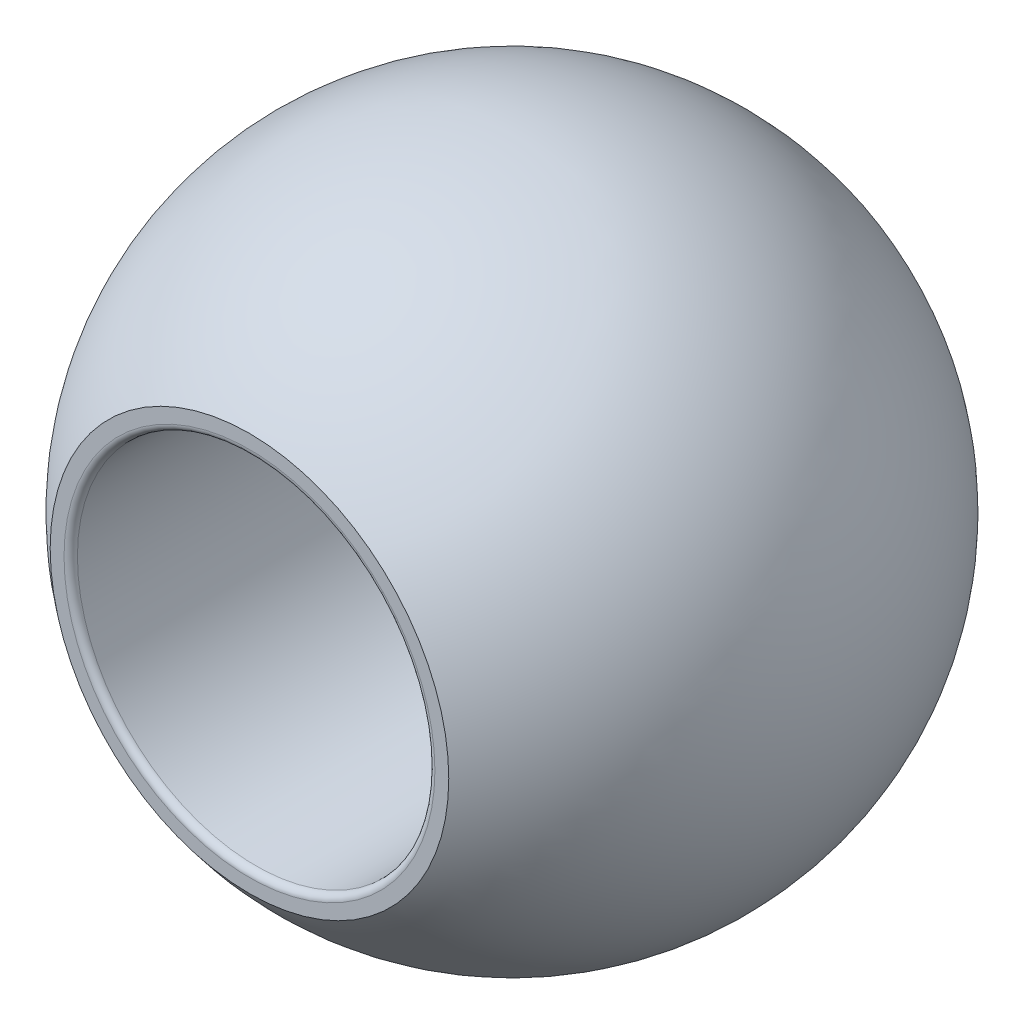
from build123d import *

# Parameters (mm, degrees)
ENL_V_MAT_EXTRU_1_REACH             = 7.11
ESQUISSE2_R                         = 1.6
ENL_V_MAT_EXTRU_1_DIRECTION_2_REACH = 7.11
ESQUISSE3_W                         = 3.87706385
ESQUISSE3_H                         = 0.15
ENL_V_MAT_EXTRU_2_DEPTH             = 6.109549882
CONG_2_R                            = 0.06
CONG_2_OF_SYM_TRIE1_R               = 0.06


with BuildPart() as part:
    # Esquisse1 → Révolution1 (revolve)
    with BuildSketch(Plane.XY):
        with BuildLine():
            Line((0, 2.95), (0, -2.95))
            ThreePointArc((0, -2.95), (-2.95, 0), (0, 2.95))
        make_face()
    revolve(axis=Axis((0, 4.043436293, 0), (0, -1, 0)))

    # Esquisse2 → Enlèv. mat.-Extru.1 (cut, up to next)
    with BuildSketch(Plane.XY, mode=Mode.PRIVATE) as enl_v_mat_extru_1_sk1:
        Circle(ESQUISSE2_R)
    enl_v_mat_extru_1_tool1 = extrude(enl_v_mat_extru_1_sk1.sketch, amount=-ENL_V_MAT_EXTRU_1_REACH, mode=Mode.PRIVATE) & part.part
    add(enl_v_mat_extru_1_tool1.solids().sort_by_distance((0, 0, 0))[0], mode=Mode.SUBTRACT)

    # Esquisse2 → Enlèv. mat.-Extru.1 direction 2 (cut, up to next)
    with BuildSketch(Plane.XY, mode=Mode.PRIVATE) as enl_v_mat_extru_1_direction_2_sk1:
        Circle(ESQUISSE2_R)
    enl_v_mat_extru_1_direction_2_tool1 = extrude(enl_v_mat_extru_1_direction_2_sk1.sketch, amount=ENL_V_MAT_EXTRU_1_DIRECTION_2_REACH, mode=Mode.PRIVATE) & part.part
    add(enl_v_mat_extru_1_direction_2_tool1.solids().sort_by_distance((0, 0, 0))[0], mode=Mode.SUBTRACT)

    # Esquisse3 → Enlèv. mat.-Extru.2 (cut, symmetric)
    with BuildSketch(Plane(origin=(0, 0, 0), x_dir=(1, 0, 0), z_dir=(0, 1, 0))):
        with Locations((0, 2.424398526)):
            Rectangle(ESQUISSE3_W, ESQUISSE3_H)
    enl_v_mat_extru_2 = extrude(amount=ENL_V_MAT_EXTRU_2_DEPTH, both=True, mode=Mode.SUBTRACT)

    # Congé2
    cong_2_edges = [part.edges().sort_by_distance(p)[0] for p in [
        (-1.6, 0, -2.349398526),
    ]]
    fillet(cong_2_edges, radius=CONG_2_R)

    # Symétrie1: Enlèv. mat.-Extru.2 across plane
    add(enl_v_mat_extru_2.mirror(Plane.XY), mode=Mode.SUBTRACT)

    # Congé2 of Symétrie1
    cong_2_of_sym_trie1_edges = [part.edges().sort_by_distance(p)[0] for p in [
        (-1.6, 0, 2.349398526),
    ]]
    fillet(cong_2_of_sym_trie1_edges, radius=CONG_2_OF_SYM_TRIE1_R)


solid = part.part
